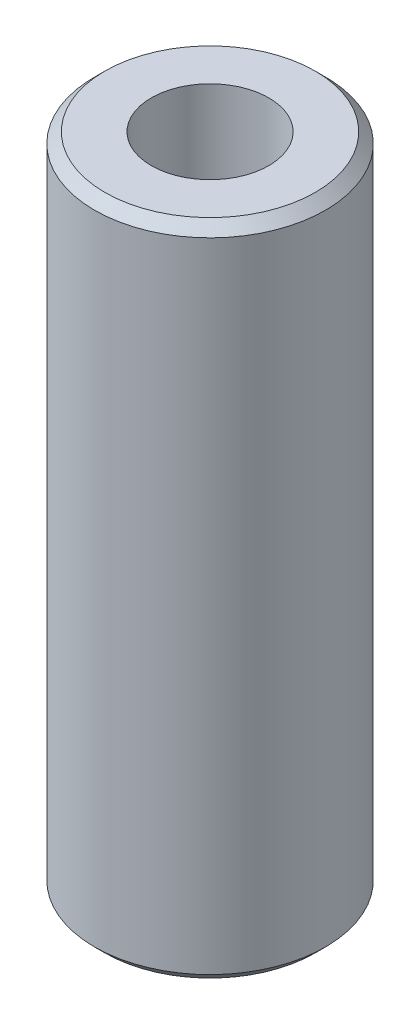
from build123d import *

# Parameters (mm, degrees)
SKETCH1_R           = 30
BOSS_EXTRUDE1_DEPTH = 171.159943896
SKETCH2_R           = 15.268597297
CUT_EXTRUDE1_DEPTH  = 177.339803772
CHAMFER1_SIZE       = 2.671215217


with BuildPart() as part:
    # Sketch1 → Boss-Extrude1 (new body)
    with BuildSketch(Plane(origin=(0, 0, 0), x_dir=(1, 0, 0), z_dir=(0, 1, 0))):
        Circle(SKETCH1_R)
    extrude(amount=BOSS_EXTRUDE1_DEPTH)

    # Sketch2 → Cut-Extrude1 (cut, through all)
    with BuildSketch(Plane(origin=(0, 0, 0), x_dir=(1, 0, 0), z_dir=(0, 1, 0))):
        Circle(SKETCH2_R)
    extrude(amount=CUT_EXTRUDE1_DEPTH, mode=Mode.SUBTRACT)

    # Chamfer1
    chamfer1_edges = [part.edges().sort_by_distance(p)[0] for p in [
        (-30, 171.159943896, 0),
        (-30, 0, 0),
    ]]
    chamfer(chamfer1_edges, length=CHAMFER1_SIZE)


solid = part.part
